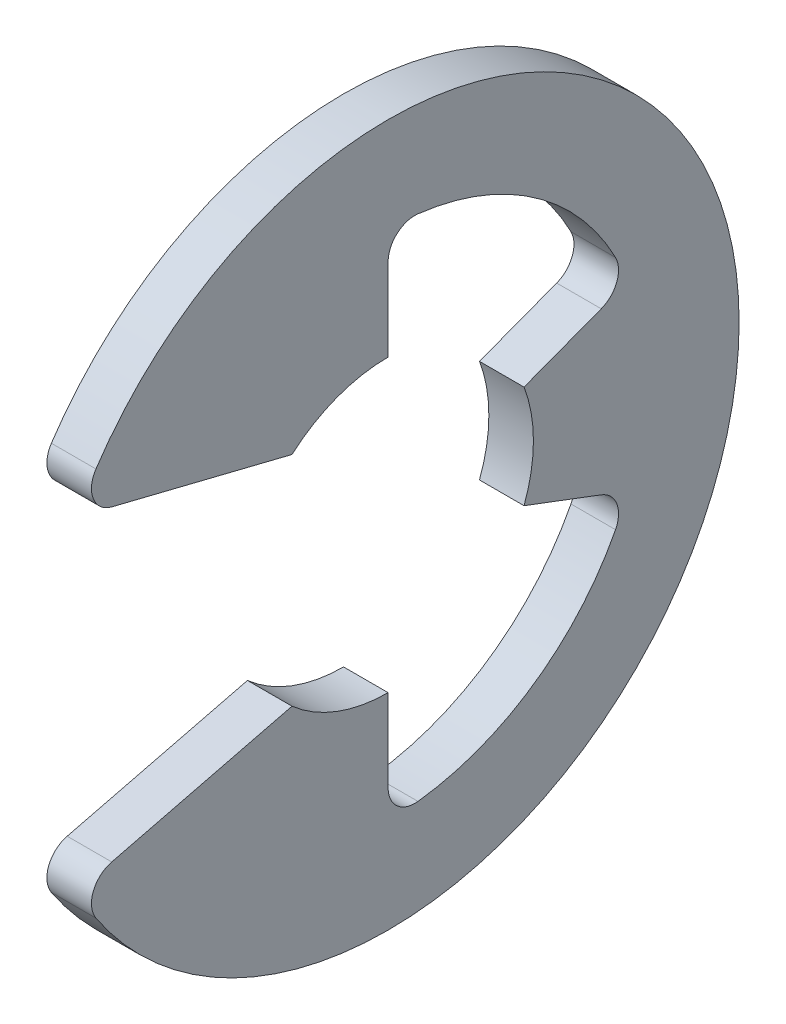
from build123d import *

# Parameters (mm, degrees)
EXTRUDE1_DEPTH = 0.5
FILLET1_R      = 0.6


with BuildPart() as part:
    # Sketch1 → Extrude1 (new, symmetric)
    with BuildSketch(Plane(origin=(0, 0, 0), x_dir=(0, 0, -1), z_dir=(1, 0, 0))):
        with BuildLine():
            Line((-6.981705618, -3.642994877), (-2.156287319, -2.445))
            ThreePointArc((-2.156287319, -2.445), (-1.152584053, -3.04945077), (0, -3.26))
            Line((0, -3.26), (0, -5.747096774))
            ThreePointArc((0, -5.747096774), (3.267381482, -4.727931851), (5.375916774, -2.031905551))
            Line((5.375916774, -2.031905551), (3.04945077, -1.152584053))
            ThreePointArc((3.04945077, -1.152584053), (3.26, 0), (3.04945077, 1.152584053))
            Line((3.04945077, 1.152584053), (5.375916774, 2.031905551))
            ThreePointArc((5.375916774, 2.031905551), (3.267381482, 4.727931851), (0, 5.747096774))
            Line((0, 5.747096774), (0, 3.26))
            ThreePointArc((0, 3.26), (-1.152584053, 3.04945077), (-2.156287319, 2.445))
            Line((-2.156287319, 2.445), (-6.981705618, 3.642994877))
            ThreePointArc((-6.981705618, 3.642994877), (7.875, 0), (-6.981705618, -3.642994877))
        make_face()
    extrude(amount=EXTRUDE1_DEPTH, both=True)

    # Fillet1
    fillet1_edges = [part.edges().sort_by_distance(p)[0] for p in [
        (0, -5.747096774, 0),
        (0, 5.747096774, 0),
        (0, -3.642994877, 6.981705618),
        (0, 3.642994877, 6.981705618),
        (0, -2.031905551, -5.375916774),
        (0, 2.031905551, -5.375916774),
    ]]
    fillet(fillet1_edges, radius=FILLET1_R)


solid = part.part
